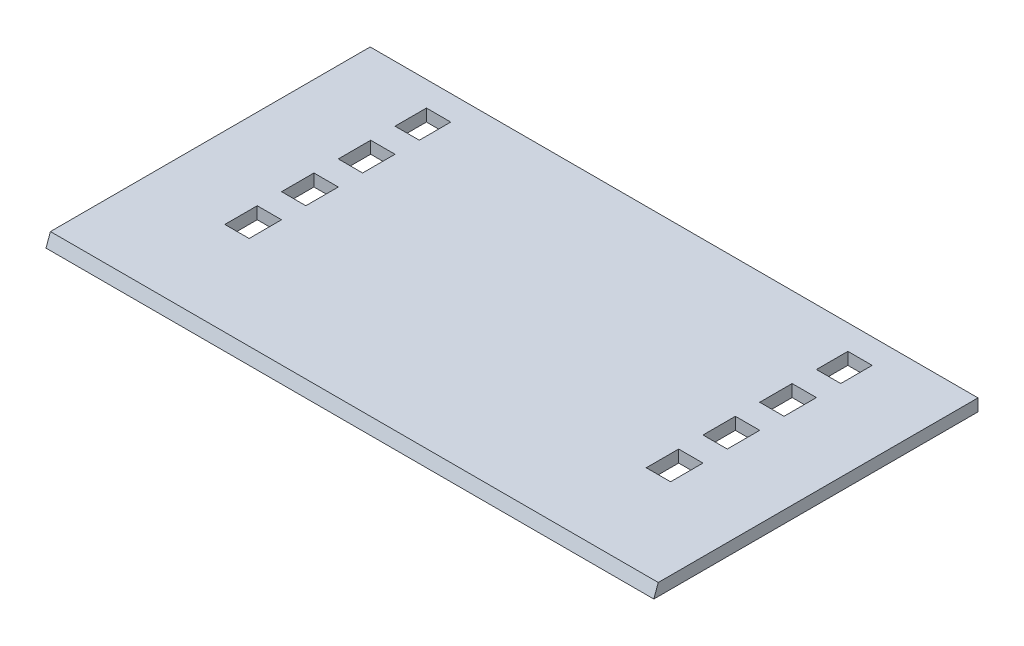
from build123d import *

# Parameters (mm, degrees)
ESQUISSE1_W             = 150
ESQUISSE1_H             = 80
BOSS_EXTRU_1_DEPTH      = 3
CHANFREIN2_SIZE2        = 1.091910703
CHANFREIN2_SIZE         = 3
ESQUISSE2_W             = 6
ESQUISSE2_H             = 7.757567742
ESQUISSE2_H_2           = 8
ENL_V_MAT_EXTRU_1_DEPTH = 3


with BuildPart() as part:
    # Esquisse1 → Boss.-Extru.1 (new body)
    with BuildSketch(Plane(origin=(0, 0, 0), x_dir=(1, 0, 0), z_dir=(0, 1, 0))):
        with Locations((75, 40)):
            Rectangle(ESQUISSE1_W, ESQUISSE1_H)
    extrude(amount=BOSS_EXTRU_1_DEPTH)

    # Chanfrein2
    chanfrein2_edges = [part.edges().sort_by_distance(p)[0] for p in [
        (75, 3, 0),
    ]]
    chanfrein2_side = [part.faces().sort_by_distance(p)[0] for p in [
        (75, 2.978161786, 0),
    ]]
    chamfer(chanfrein2_edges, length=CHANFREIN2_SIZE - 0.0001, length2=CHANFREIN2_SIZE2 - 0.0001, reference=chanfrein2_side[0])  # a hair under: the kernel refuses the full size

    # Esquisse2 → Enlèv. mat.-Extru.1 (cut)
    with BuildSketch(Plane(origin=(0, 3, 0), x_dir=(1, 0, 0), z_dir=(0, 1, 0))):
        with Locations((127, 70.007139416)):
            Rectangle(ESQUISSE2_W, ESQUISSE2_H)
        with Locations((127, 56.128355545)):
            Rectangle(ESQUISSE2_W, ESQUISSE2_H_2)
        with Locations((127, 42.128355545)):
            Rectangle(ESQUISSE2_W, ESQUISSE2_H_2)
        with Locations((127, 28.128355545)):
            Rectangle(ESQUISSE2_W, ESQUISSE2_H_2)
        with Locations((23, 28.128355545)):
            Rectangle(ESQUISSE2_W, ESQUISSE2_H_2)
        with Locations((23, 42.128355545)):
            Rectangle(ESQUISSE2_W, ESQUISSE2_H_2)
        with Locations((23, 56.128355545)):
            Rectangle(ESQUISSE2_W, ESQUISSE2_H_2)
        with Locations((23, 70.007139416)):
            Rectangle(ESQUISSE2_W, ESQUISSE2_H)
    extrude(amount=-ENL_V_MAT_EXTRU_1_DEPTH, mode=Mode.SUBTRACT)


solid = part.part
